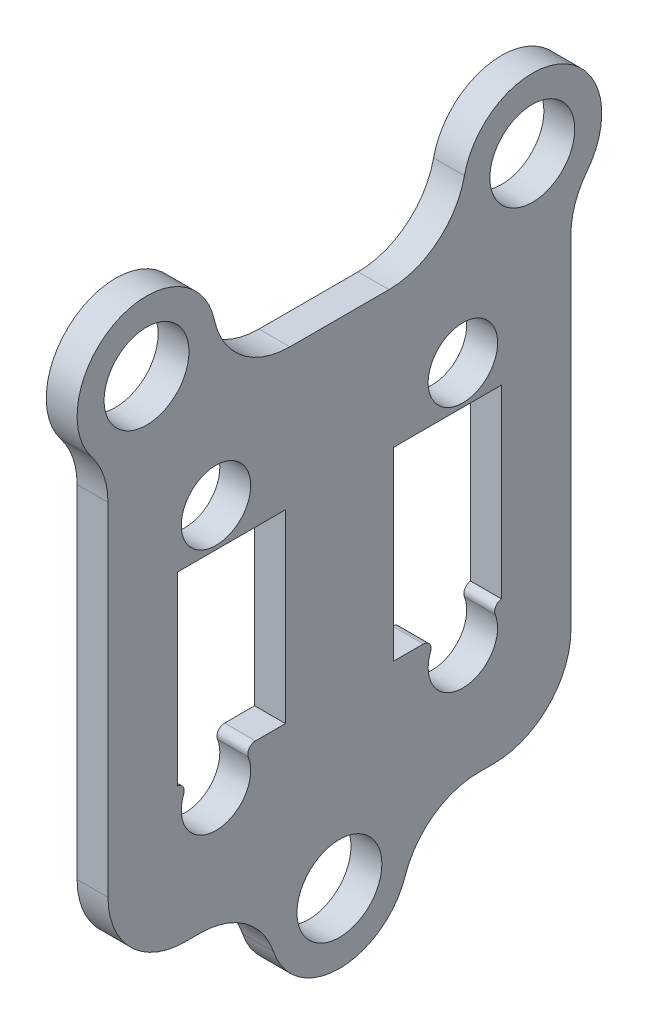
from build123d import *

# Parameters (mm, degrees)
SKETCH1_W            = 30
SKETCH1_H            = 30
BOSS_EXTRUDE1_DEPTH  = 2
SKETCH2_W            = 7
SKETCH2_H            = 12
CUT_EXTRUDE1_DEPTH   = 22.307275753
M4_CLEARANCE_HOLE1_D = 4.5
BOSS_EXTRUDE2_DEPTH  = 2
M5_CLEARANCE_HOLE1_D = 5.5
FILLET1_R            = 5
FILLET2_R            = 0.5


with BuildPart() as part:
    # Sketch1 → Boss-Extrude1 (new body)
    with BuildSketch(Plane(origin=(0, 0, 0), x_dir=(0, 0, -1), z_dir=(1, 0, 0))):
        Rectangle(SKETCH1_W, SKETCH1_H)
    extrude(amount=BOSS_EXTRUDE1_DEPTH)

    # Sketch2 → Cut-Extrude1 (cut, through all)
    with BuildSketch(Plane(origin=(2, 0, 0), x_dir=(0, 0, -1), z_dir=(1, 0, 0))):
        with Locations((-7, 0)):
            Rectangle(SKETCH2_W, SKETCH2_H)
        with Locations((7, 0)):
            Rectangle(SKETCH2_W, SKETCH2_H)
    extrude(amount=-CUT_EXTRUDE1_DEPTH, mode=Mode.SUBTRACT)

    # M4 Clearance Hole1 (through all)
    with Locations(Plane(origin=(2, 0, 0), x_dir=(0, 0, -1), z_dir=(1, 0, 0))):
        with Locations((-8, 8.5), (-8, -7.5), (8, 8.5), (8, -7.5)):
            Hole(M4_CLEARANCE_HOLE1_D / 2)

    # Sketch6 → Boss-Extrude2 (add)
    with BuildSketch(Plane(origin=(2, 0, 0), x_dir=(0, 0, -1), z_dir=(1, 0, 0))):
        with BuildLine():
            Line((-15, 14.258342613), (-15, 15))
            Line((-15, 15), (-9.145898034, 15))
            ThreePointArc((-9.145898034, 15), (-13.065585062, 22.464315573), (-15, 14.258342613))
        make_face()
        with BuildLine():
            Line((15, 14.258342613), (15, 15))
            Line((15, 15), (9.145898034, 15))
            ThreePointArc((9.145898034, 15), (13.065585062, 22.464315573), (15, 14.258342613))
        make_face()
        with BuildLine():
            Line((-4.031128874, -15), (4.031128874, -15))
            ThreePointArc((4.031128874, -15), (0, -21.5), (-4.031128874, -15))
        make_face()
    extrude(amount=-BOSS_EXTRUDE2_DEPTH)

    # M5 Clearance Hole1 (through all)
    with Locations(Plane(origin=(2, 0, 0), x_dir=(0, 0, -1), z_dir=(1, 0, 0))):
        with Locations((-12.5, 18), (12.5, 18), (0, -17)):
            Hole(M5_CLEARANCE_HOLE1_D / 2)

    # Fillet1
    fillet1_edges = [part.edges().sort_by_distance(p)[0] for p in [
        (1, -15, -15),
        (1, -15, 15),
        (1, 14.258342613, 15),
        (1, 15, 9.145898034),
        (1, 14.258342613, -15),
        (1, 15, -9.145898034),
        (1, -15, 4.031128874),
        (1, -15, -4.031128874),
    ]]
    fillet(fillet1_edges, radius=FILLET1_R)

    # Fillet2
    # the kernel refuses this fillet: 0.5 mm, written as the material it takes off along each edge
    with BuildSketch(Plane(origin=(4.211716771, -6, -6.322949017), x_dir=(0, 0, 1), z_dir=(-1, 0, 0))) as fillet2_piece_1:
        with BuildLine():
            CenterArc((0.884686708, -0.5), FILLET2_R, 90, 111.323686263)
            Line((0.418916219, -0.681818182), (0.409600809, -0.685454545))
            ThreePointArc((0.409600809, -0.685454545), (0.23149304, -0.327370599), (-0.00745356, -0.006666667))
            Line((-0.00745356, -0.006666667), (0, 0.01))
            Line((0, 0.01), (0.884686708, 0.01))
            Line((0.884686708, 0.01), (0.884686708, 0))
        make_face()
    extrude(amount=6.423433542, mode=Mode.SUBTRACT)
    with BuildSketch(Plane(origin=(4.057372542, -6, -9.677050983), x_dir=(0, -0.851655260409685, -0.5241023921110375), z_dir=(-1, 0, 0))) as fillet2_piece_2:
        with BuildLine():
            CenterArc((0.885636575, -0.492093973), FILLET2_R, 100.202478529, 104.477512186)
            Line((0.431309548, -0.700868859), (0.422223008, -0.705044357))
            ThreePointArc((0.422223008, -0.705044357), (0.207138222, -0.355675454), (-0.008516553, -0.005241024))
            Line((-0.008516553, -0.005241024), (0.001771273, 0.009841879))
            ThreePointArc((0.001771273, 0.009841879), (0.398536459, -0.02557712), (0.795301644, 0.009841879))
            Line((0.795301644, 0.009841879), (0.797072917, 0))
        make_face()
    extrude(amount=6.114745084, mode=Mode.SUBTRACT)
    with BuildSketch(Plane(origin=(4.057372542, -6, 9.677050983), x_dir=(0, 0, 1), z_dir=(-1, 0, 0))) as fillet2_piece_3:
        with BuildLine():
            CenterArc((0.883258668, -0.496349419), FILLET2_R, 96.927845653, 104.477512186)
            Line((0.417747823, -0.678831343), (0.408437606, -0.682480981))
            ThreePointArc((0.408437606, -0.682480981), (0.2306568, -0.326010642), (-0.00745356, -0.006666667))
            Line((-0.00745356, -0.006666667), (0, 0.01))
            ThreePointArc((0, 0.01), (0.411474508, 0.01), (0.821742824, 0.009926988))
            Line((0.821742824, 0.009926988), (0.822949017, 0))
        make_face()
    extrude(amount=6.114745084, mode=Mode.SUBTRACT)
    with BuildSketch(Plane(origin=(4.211716771, -6, 6.322949017), x_dir=(0, -0.8520285817760733, -0.5234952682084655), z_dir=(-1, 0, 0))) as fillet2_piece_4:
        with BuildLine():
            CenterArc((0.889143597, -0.492030727), FILLET2_R, 100.243314316, 111.323686264)
            Line((0.463129306, -0.753778361), (0.45460902, -0.759013314))
            Line((0.45460902, -0.759013314), (-0.008520286, -0.005234953))
            Line((-0.008520286, -0.005234953), (0.001778287, 0.009840615))
            ThreePointArc((0.001778287, 0.009840615), (0.400114618, -0.025861727), (0.79845095, 0.009840615))
            Line((0.79845095, 0.009840615), (0.800229237, 0))
        make_face()
    extrude(amount=6.423433542, mode=Mode.SUBTRACT)


solid = part.part
